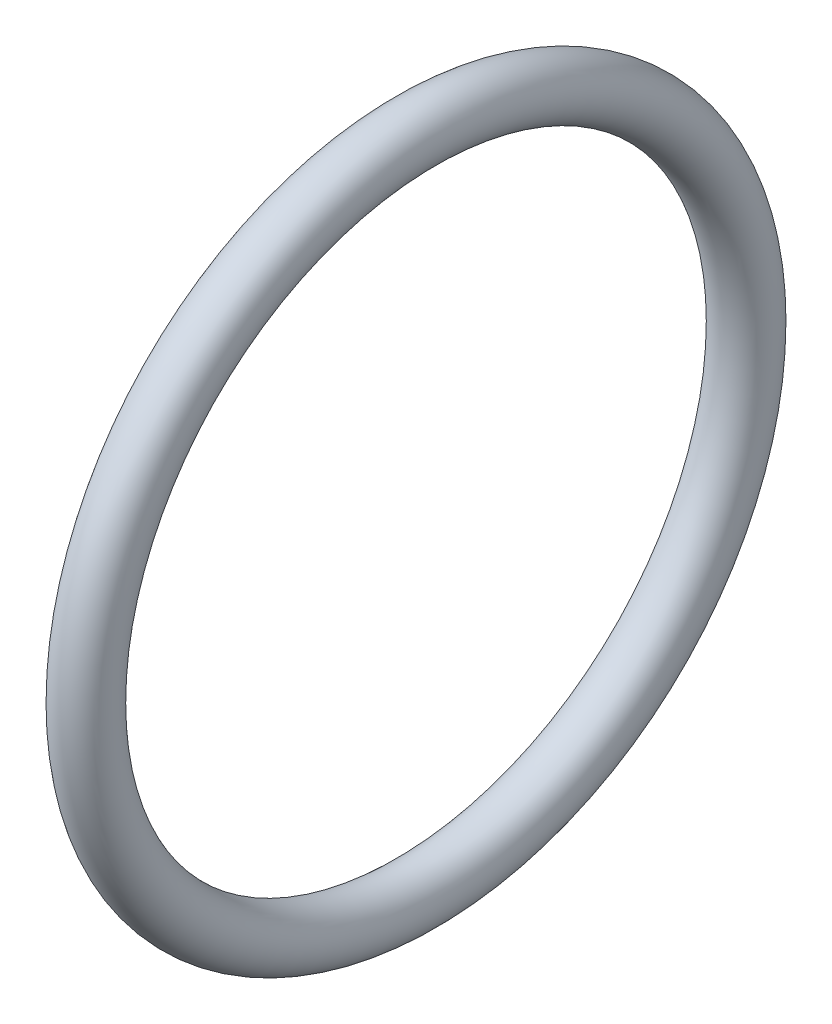
from build123d import *

# Parameters (mm, degrees)
SKETCH3_R = 0.699999997


with BuildPart() as part:
    # Sketch3 → Revolve1 (revolve)
    with BuildSketch(Plane.XY):
        with Locations((17.330400061, 8.199999983)):
            Circle(SKETCH3_R)
    revolve(axis=Axis((0, 0, 0), (1, 0, 0)))


solid = part.part
